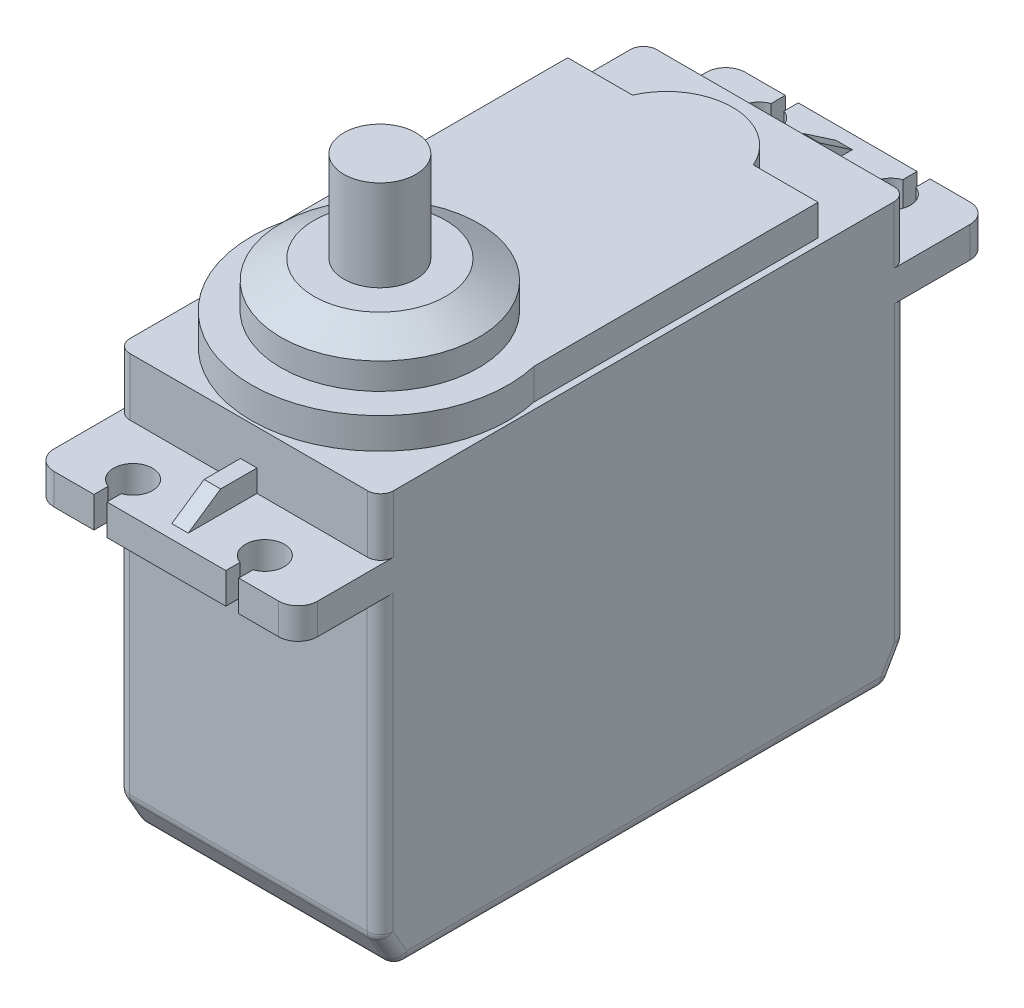
from build123d import *
from OCP.BRepFilletAPI import BRepFilletAPI_MakeChamfer

# Parameters (mm, degrees)
SKETCH1_W           = 20.32
SKETCH1_H           = 40.64
BOSS_EXTRUDE1_DEPTH = 25.4
SKETCH2_W           = 20.32
SKETCH2_H           = 40.64
BOSS_EXTRUDE2_DEPTH = 2.38
SKETCH3_W           = 20.32
SKETCH3_H           = 40.5892
BOSS_EXTRUDE3_DEPTH = 4.445
BOSS_EXTRUDE4_DEPTH = 2.38
SKETCH6_R           = 7.62
BOSS_EXTRUDE5_DEPTH = 3.495
CHAMFER1_SIZE       = 2.54
CHAMFER1_SIZE2      = 1.466469684
BOSS_EXTRUDE6_DEPTH = 0.635
SKETCH9_R           = 2.78
BOSS_EXTRUDE7_DEPTH = 7
CHAMFER2_SIZE       = 2.54
CHAMFER2_SIZE2      = 1.466469684
FILLET1_R           = 1
FILLET2_R           = 1.5
SKETCH10_W          = 6.35
SKETCH10_H          = 2.54
SKETCH10_W_2        = 5.08
SKETCH10_H_2        = 1.27
BOSS_EXTRUDE8_DEPTH = 2.4


with BuildPart() as part:
    # Sketch1 → Boss-Extrude1 (new body)
    with BuildSketch(Plane(origin=(0, 0, 0), x_dir=(1, 0, 0), z_dir=(0, 1, 0))):
        with Locations((0, -10.16)):
            Rectangle(SKETCH1_W, SKETCH1_H)
    extrude(amount=BOSS_EXTRUDE1_DEPTH)

    # Sketch2 → Boss-Extrude2 (add)
    with BuildSketch(Plane(origin=(0, 25.4, 0), x_dir=(1, 0, 0), z_dir=(0, 1, 0))):
        with BuildLine():
            ThreePointArc((-5.58, 15.384213562), (-5.08, 12.47), (-4.58, 15.384213562))
            Line((-4.58, 15.384213562), (-4.58, 16.4846))
            Line((-4.58, 16.4846), (4.58, 16.4846))
            Line((4.58, 16.4846), (4.58, 15.384213562))
            ThreePointArc((4.58, 15.384213562), (5.08, 12.47), (5.58, 15.384213562))
            Line((5.58, 15.384213562), (5.58, 16.4846))
            Line((5.58, 16.4846), (10.16, 16.4846))
            Line((10.16, 16.4846), (10.16, 10.16))
            Line((10.16, 10.16), (-10.16, 10.16))
            Line((-10.16, 10.16), (-10.16, 16.4846))
            Line((-10.16, 16.4846), (-5.58, 16.4846))
            Line((-5.58, 16.4846), (-5.58, 15.384213562))
        make_face()
        with Locations((0, -10.16)):
            Rectangle(SKETCH2_W, SKETCH2_H)
        with BuildLine():
            ThreePointArc((5.58, -35.704213562), (5.08, -32.79), (4.58, -35.704213562))
            Line((4.58, -35.704213562), (4.58, -36.8046))
            Line((4.58, -36.8046), (-4.58, -36.8046))
            Line((-4.58, -36.8046), (-4.58, -35.704213562))
            ThreePointArc((-4.58, -35.704213562), (-5.08, -32.79), (-5.58, -35.704213562))
            Line((-5.58, -35.704213562), (-5.58, -36.8046))
            Line((-5.58, -36.8046), (-10.16, -36.8046))
            Line((-10.16, -36.8046), (-10.16, -30.48))
            Line((-10.16, -30.48), (10.16, -30.48))
            Line((10.16, -30.48), (10.16, -36.8046))
            Line((10.16, -36.8046), (5.58, -36.8046))
            Line((5.58, -36.8046), (5.58, -35.704213562))
        make_face()
    extrude(amount=BOSS_EXTRUDE2_DEPTH)

    # Sketch3 → Boss-Extrude3 (add)
    with BuildSketch(Plane(origin=(0, 27.78, 0), x_dir=(1, 0, 0), z_dir=(0, 1, 0))):
        with Locations((0, -10.16)):
            Rectangle(SKETCH3_W, SKETCH3_H)
    extrude(amount=BOSS_EXTRUDE3_DEPTH)

    # Sketch4 → Boss-Extrude4 (add)
    with BuildSketch(Plane(origin=(0, 32.225, 0), x_dir=(1, 0, 0), z_dir=(0, 1, 0))):
        with BuildLine():
            Line((9.652, -18.116559046), (9.652, 3.7846))
            Line((9.652, 3.7846), (4.655896906, 3.7846))
            ThreePointArc((4.655896906, 3.7846), (0, 6.8326), (-4.655896906, 3.7846))
            Line((-4.655896906, 3.7846), (-9.652, 3.7846))
            Line((-9.652, 3.7846), (-9.652, -18.116559046))
            ThreePointArc((-9.652, -18.116559046), (0, -30.2514), (9.652, -18.116559046))
        make_face()
    extrude(amount=BOSS_EXTRUDE4_DEPTH)

    # Sketch6 → Boss-Extrude5 (add)
    with BuildSketch(Plane(origin=(0, 34.605, 0), x_dir=(1, 0, 0), z_dir=(0, 1, 0))):
        with Locations(Location((0, -20.3454, 0), (0, 0, 270))):
            Circle(SKETCH6_R)
    extrude(amount=BOSS_EXTRUDE5_DEPTH)

    # Chamfer1
    chamfer1_edges = [part.edges().sort_by_distance(p)[0] for p in [
        (0, 38.1, 12.7254),
    ]]
    chamfer1_side = [part.faces().sort_by_distance(p)[0] for p in [
        (0, 38.1, 20.3454),
    ]]
    chamfer(chamfer1_edges, length=CHAMFER1_SIZE, length2=CHAMFER1_SIZE2, reference=chamfer1_side[0])

    # Sketch8 → Boss-Extrude6 (add, symmetric)
    with BuildSketch(Plane(origin=(0, 0, 0), x_dir=(0, 0, -1), z_dir=(1, 0, 0))):
        Polygon((-30.4546, 27.78), (-30.4546, 29.48), (-33.2546, 29.48), (-35.7546, 27.78), align=None)
    boss_extrude6 = extrude(amount=BOSS_EXTRUDE6_DEPTH, both=True)

    # Mirror1: Boss-Extrude6 across plane
    add(boss_extrude6.mirror(Plane.XY.offset(10.16)))

    # Sketch9 → Boss-Extrude7 (add)
    with BuildSketch(Plane(origin=(0, 38.1, 0), x_dir=(1, 0, 0), z_dir=(0, 1, 0))):
        with Locations(Location((0, -20.3454, 0), (0, 0, 270))):
            Circle(SKETCH9_R)
    extrude(amount=BOSS_EXTRUDE7_DEPTH)

    # Chamfer2: one chamfer whose edges measure the first distance from different faces: ONE call of the kernel's chamfer builder (chamfer() names one face for all edges)
    chamfer2_edges_1 = [part.edges().sort_by_distance(p)[0] for p in [
        (0, 0, -10.16),
    ]]
    chamfer2_side_1 = [part.faces().sort_by_distance(p)[0] for p in [
        (0, 12.7, -10.16),
    ]]
    chamfer2_edges_2 = [part.edges().sort_by_distance(p)[0] for p in [
        (0, 0, 30.48),
    ]]
    chamfer2_side_2 = [part.faces().sort_by_distance(p)[0] for p in [
        (0, 12.7, 30.48),
    ]]
    chamfer2 = BRepFilletAPI_MakeChamfer(part.part.solid().wrapped)
    for e in chamfer2_edges_1:
        chamfer2.Add(CHAMFER2_SIZE, CHAMFER2_SIZE2, e.wrapped, chamfer2_side_1[0].wrapped)  # the first distance lies on this face
    for e in chamfer2_edges_2:
        chamfer2.Add(CHAMFER2_SIZE, CHAMFER2_SIZE2, e.wrapped, chamfer2_side_2[0].wrapped)  # the first distance lies on this face
    add(Compound.cast(chamfer2.Shape()), mode=Mode.REPLACE)

    # Fillet1
    fillet1_edges = [part.edges().sort_by_distance(p)[0] for p in [
        (-10.16, 30.0025, -10.1346),
        (-10.16, 13.97, -10.16),
        (-10.16, 1.27, -9.426765158),
        (-10.16, 0, 10.16),
        (0, 0, -8.693530316),
        (0, 2.54, -10.16),
        (10.16, 1.27, -9.426765158),
        (10.16, 0, 10.16),
        (0, 0, 29.013530316),
        (10.16, 1.27, 29.746765158),
        (0, 2.54, 30.48),
        (10.16, 13.97, -10.16),
        (10.16, 30.0025, -10.1346),
        (-10.16, 30.0025, 30.4546),
        (10.16, 30.0025, 30.4546),
        (-10.16, 13.97, 30.48),
        (10.16, 13.97, 30.48),
        (-10.16, 1.27, 29.746765158),
    ]]
    fillet(fillet1_edges, radius=FILLET1_R)

    # Fillet2
    fillet2_edges = [part.edges().sort_by_distance(p)[0] for p in [
        (-10.16, 26.59, -16.4846),
        (10.16, 26.59, -16.4846),
        (10.16, 26.59, 36.8046),
        (-10.16, 26.59, 36.8046),
    ]]
    fillet(fillet2_edges, radius=FILLET2_R)

    # Sketch10 → Boss-Extrude8 (add)
    with BuildSketch(Plane(origin=(0, 0, -10.16), x_dir=(-1, 0, 0), z_dir=(0, 0, -1))):
        with Locations((0, 4.32)):
            Rectangle(SKETCH10_W, SKETCH10_H)
        with Locations((0, 4.32)):
            Rectangle(SKETCH10_W_2, SKETCH10_H_2, mode=Mode.SUBTRACT)
    extrude(amount=BOSS_EXTRUDE8_DEPTH)


with BuildPart() as part_1:
    # Body-Move/Copy1: read off the stored shape, not the designer's step
    # Body-Move/Copy1: moved
    add(part.part.moved(Location((0, -40.6, -20.3454))))


solid = part_1.part
